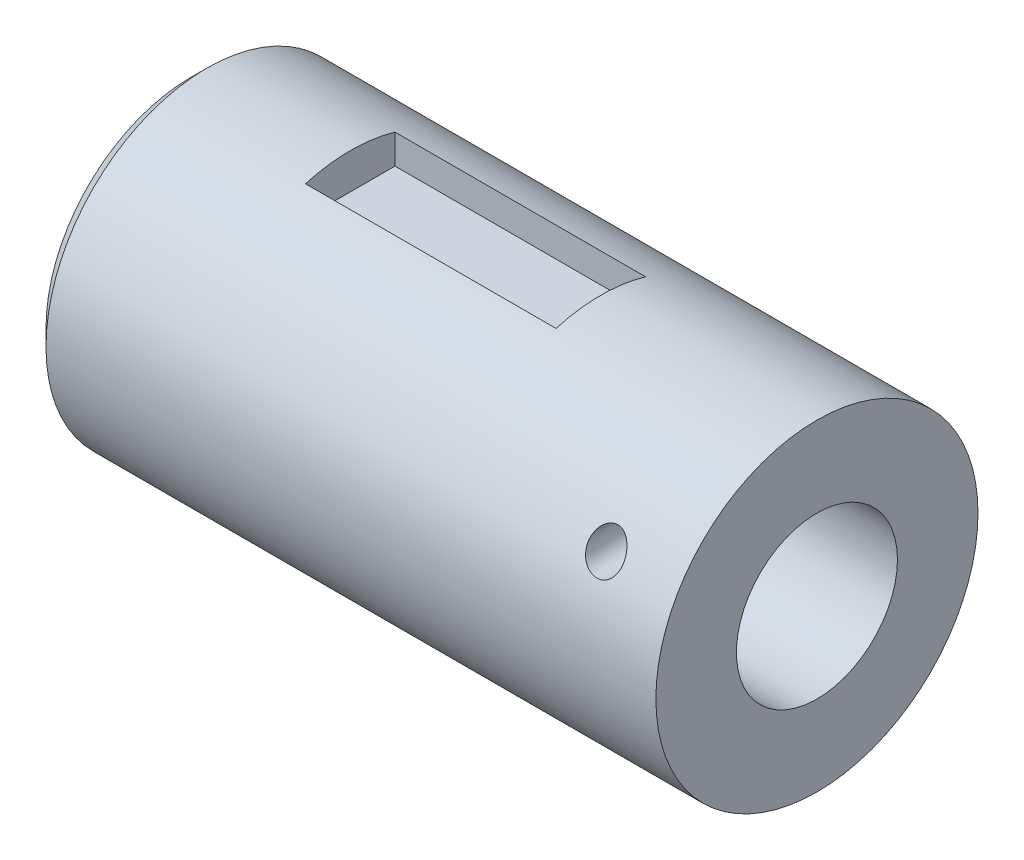
from build123d import *

# Parameters (mm, degrees)
CUT_EXTRUDE1_DEPTH      = 30
CUT_EXTRUDE1_DEPTH_BACK = 41
SKETCH2_R               = 2
SKETCH3_W               = 28
SKETCH3_H               = 10
CUT_EXTRUDE2_DEPTH      = 4


with BuildPart() as part:
    # Sketch1 → Revolve1 (revolve)
    with BuildSketch(Plane.XY):
        Polygon((-59.402075998, 14), (-59.402075998, 16.159863786), (-57.561939784, 18), (10.597924002, 18), (10.597924002, 9), (-3.402075998, 9), (-3.402075998, 12), (-13.402075998, 12), (-13.402075998, 9), (-49.402075998, 9), (-49.402075998, 14), align=None)
    revolve(axis=Axis((38.681885012, 0, 0), (-1, 0, 0)))

    # Sketch2 → Cut-Extrude1 (cut, two sides: drawn at the far end of the back side and taken through both)
    with BuildSketch(Plane.XY.offset(-CUT_EXTRUDE1_DEPTH_BACK)):
        with Locations((2.597924002, 9)):
            Circle(SKETCH2_R)
    extrude(amount=CUT_EXTRUDE1_DEPTH + CUT_EXTRUDE1_DEPTH_BACK, mode=Mode.SUBTRACT)

    # Sketch3 → Cut-Extrude2 (cut)
    with BuildSketch(Plane(origin=(0, 18, 0), x_dir=(1, 0, 0), z_dir=(0, 1, 0))):
        with Locations((-27.561939784, 0)):
            Rectangle(SKETCH3_W, SKETCH3_H)
    extrude(amount=-CUT_EXTRUDE2_DEPTH, mode=Mode.SUBTRACT)


solid = part.part
